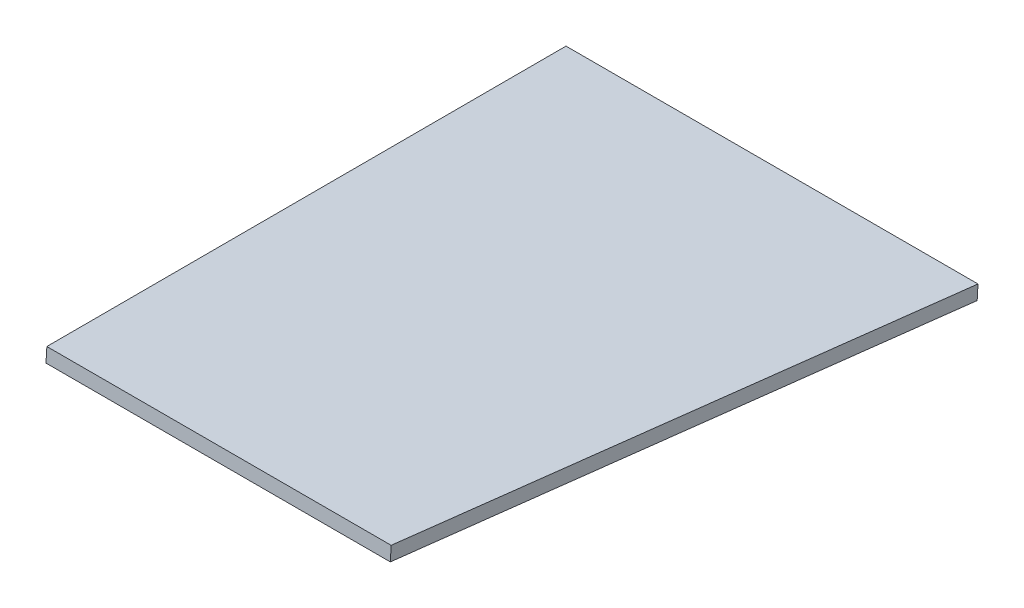
from build123d import *

# Parameters (mm, degrees)
BOSS_EXTRUDE1_DEPTH = 12.7


with BuildPart() as part:
    # PedalBox Floor → Boss-Extrude1 (new body)
    with BuildSketch(Plane(origin=(0, -11.912117549, 0.716369544), x_dir=(-1, 0, 0), z_dir=(0, -0.9981966075420027, 0.060029431878345973))):
        Polygon((379.761537954, -1353.007868005), (410.470933114, -1855.750165961), (722.92899612, -1855.750165961), (753.63839128, -1353.007868005), align=None)
    extrude(amount=BOSS_EXTRUDE1_DEPTH)


solid = part.part
